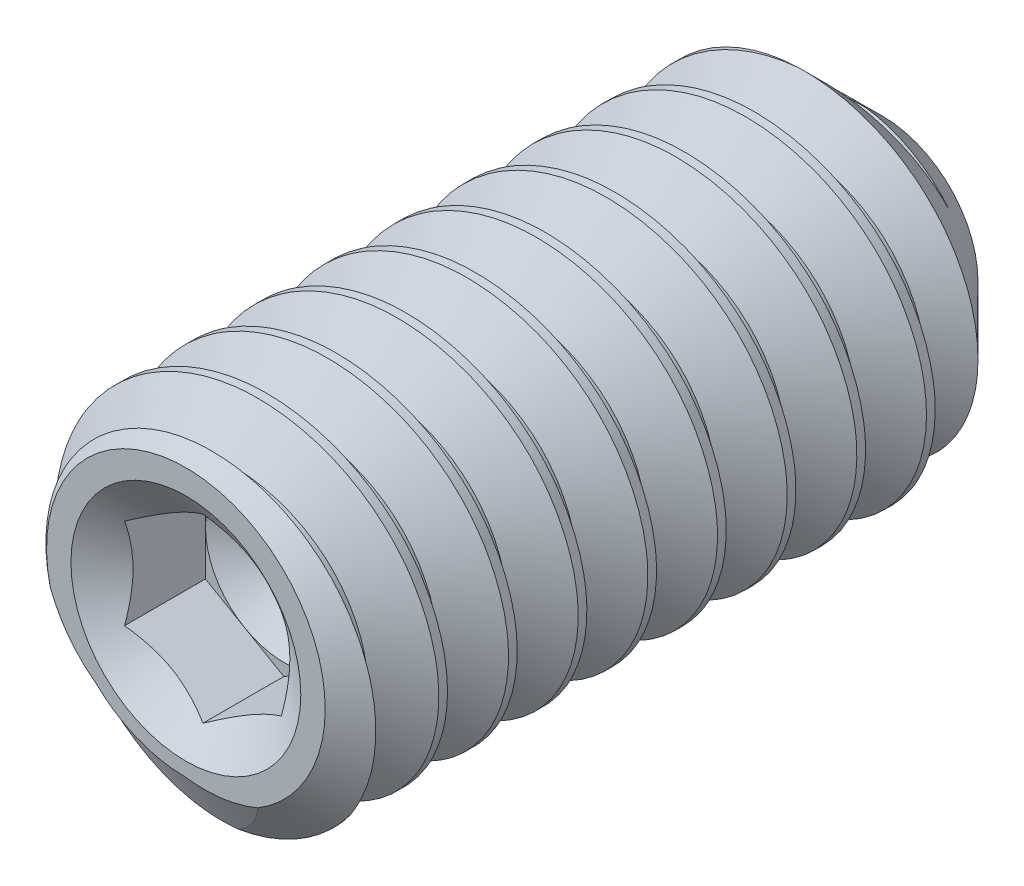
from build123d import *

# Parameters (mm, degrees)
CUT_EXTRUDE1_DEPTH = 0.5625
CUT_SWEEP1_PITCH   = 0.4


with BuildPart() as part:
    # Sketch1 → Revolve1 (revolve)
    with BuildSketch(Plane(origin=(0, 0, 0), x_dir=(0, 0, -1), z_dir=(1, 0, 0)), mode=Mode.PRIVATE) as revolve1_sk:
        Polygon((-1.835374734, 0), (-1.835374734, 0.8), (-1.695333226, 1), (1.712590173, 1), (2.164625266, 0.547964906), (1.835374734, 0), align=None)
    revolve(revolve1_sk.sketch.rotate(Axis((0, 0, -1.835374734), (0, 0, -1)), 180), axis=Axis((0, 0, -1.835374734), (0, 0, -1)))

    # Sketch2 → Cut-Extrude1 (cut)
    with BuildSketch(Plane.XY.offset(1.835374734)):
        Polygon((0, 0.519615242), (-0.45, 0.259807621), (-0.45, -0.259807621), (0, -0.519615242), (0.45, -0.259807621), (0.45, 0.259807621), align=None)
    extrude(amount=-CUT_EXTRUDE1_DEPTH, mode=Mode.SUBTRACT)

    # Cut-Extrude2 cone 1 section (through the dimple's axis) → Cut-Extrude2 (revolve, cut)
    with BuildSketch(Plane(origin=(0, 0, 1.835374734), x_dir=(0, -1, 0), z_dir=(1, 0, 0))):
        Polygon((0, 0), (0.659807621, 0), (0, 0.46200227), align=None)
    revolve(axis=Axis((0, 0, 1.835374734), (0, 0, -1)), mode=Mode.SUBTRACT)

    # Cut-Extrude3 cone 1 section (through the dimple's axis) → Cut-Extrude3 (revolve, cut)
    with BuildSketch(Plane(origin=(0, 0, 1.272874734), x_dir=(0, -1, 0), z_dir=(1, 0, 0))):
        Polygon((0, 0), (0.45, 0), (0, 0.259807621), align=None)
    revolve(axis=Axis((0, 0, 1.272874734), (0, 0, -1)), mode=Mode.SUBTRACT)

    # Cut-Sweep1: the profile of Sketch6 screwed along a right-hand helix of 11 turns, 6 arcs to a turn; built about Z, then put on its axis
    cut_sweep1_z = Axis((0, 0, 0), (0, 0, 1))
    cut_sweep1_corners = [(0.740192379, 0, -0.15), (1.021650635, 0, 0.0125), (1.021650635, 0, -0.3625), (0.740192379, 0, -0.2)]
    with BuildLine(mode=Mode.PRIVATE) as cut_sweep1_profile:
        Line(cut_sweep1_corners[0], cut_sweep1_corners[1])
        Line(cut_sweep1_corners[1], cut_sweep1_corners[2])
        Line(cut_sweep1_corners[2], cut_sweep1_corners[3])
        Line(cut_sweep1_corners[3], cut_sweep1_corners[0])
    cut_sweep1_cap = Face(cut_sweep1_profile.wire())
    cut_sweep1_turn_angles = [0, 30, 60, 90, 120, 150, 180, 210, 240, 270, 300, 330, 360]
    cut_sweep1_turn_weights = [1, 0.8660254037844387, 1, 0.8660254037844387, 1, 0.8660254037844387, 1, 0.8660254037844387, 1, 0.8660254037844387, 1, 0.8660254037844387, 1]
    cut_sweep1_turn_rails = [Edge.make_bspline([Vector(p[0], p[1], 0).rotate(cut_sweep1_z, cut_sweep1_turn_angles[k]) / cut_sweep1_turn_weights[k] + Vector(0, 0, p[2] + CUT_SWEEP1_PITCH * cut_sweep1_turn_angles[k] / 360) for k in range(13)], [0, 0, 0, 1, 1, 2, 2, 3, 3, 4, 4, 5, 5, 6, 6, 6], 2, cut_sweep1_turn_weights) for p in cut_sweep1_corners]
    cut_sweep1_turn_sides = [Face.make_surface_from_curves(cut_sweep1_turn_rails[p[0]], cut_sweep1_turn_rails[p[1]]) for p in [(0, 1), (1, 2), (2, 3), (3, 0)]]
    cut_sweep1 = Plane(origin=(0, 0, -2.164625266), x_dir=(0, 1, 0), z_dir=(0, 0, 1)) * Solid(Shell([*[p.moved(Location((0, 0, CUT_SWEEP1_PITCH * i))) for i in range(11) for p in cut_sweep1_turn_sides], cut_sweep1_cap, cut_sweep1_cap.rotate(cut_sweep1_z, 3960).moved(Location((0, 0, CUT_SWEEP1_PITCH * 3960 / 360)))]))
    add(cut_sweep1, mode=Mode.SUBTRACT)


solid = part.part
